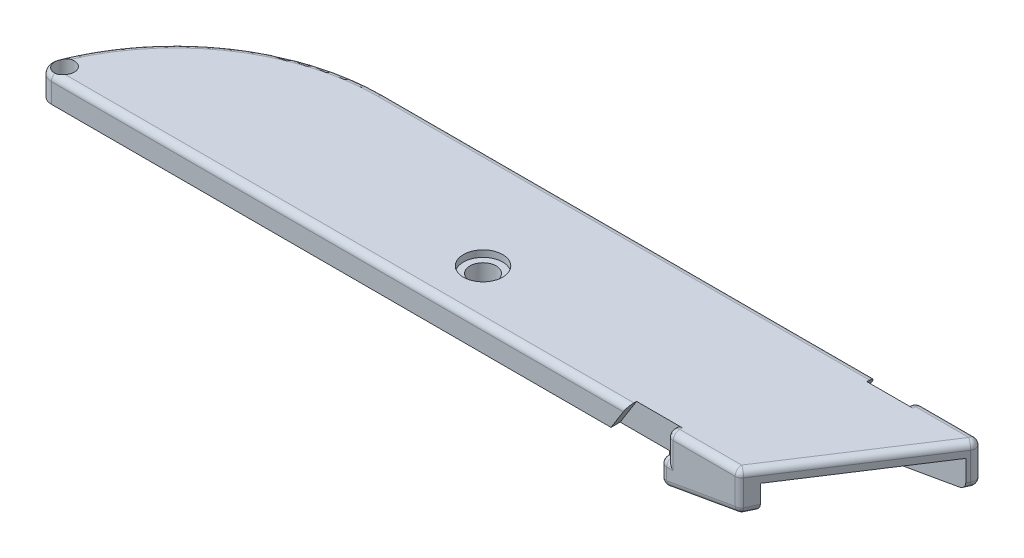
from build123d import *
from build123d.topology import SkipClean

# Parameters (mm, degrees)
BOSS_EXTRUDE1_DEPTH                                 = 10.16
CBORE_FOR_0_BINDING_HEAD_MACHINE_SCREW1_D           = 5.08
CBORE_FOR_0_BINDING_HEAD_MACHINE_SCREW1_CBORE_D     = 7.62
CBORE_FOR_0_BINDING_HEAD_MACHINE_SCREW1_CBORE_DEPTH = 1.27
SHELL1_OUTLINE_R                                    = 6.35
SHELL1_DEPTH                                        = 7.62
SHELL1_2_OUTLINE_R                                  = 6.35
SHELL1_2_OUTLINE_R_2                                = 5.08
SHELL1_2_DEPTH                                      = 6.35
CUT_EXTRUDE1_DEPTH                                  = 1.778
CUT_EXTRUDE2_DEPTH                                  = 1.778
CUT_EXTRUDE5_REACH                                  = 157.506
CUT_EXTRUDE6_REACH                                  = 157.506
CUT_EXTRUDE3_DEPTH                                  = 156.506301159
CUT_EXTRUDE3_DEPTH_BACK                             = 156.506301159
SKETCH4_W                                           = 120.65
SKETCH4_H                                           = 5.08
SKETCH5_W                                           = 19.05
SKETCH5_H                                           = 5.08
CUT_EXTRUDE4_DEPTH                                  = 2.54
SKETCH9_W                                           = 47.752
SKETCH9_H                                           = 3.81
CUT_EXTRUDE7_DEPTH                                  = 2.413
FILLET1_R                                           = 1.27
BOSS_EXTRUDE2_DEPTH                                 = 2.54
SKETCH11_W                                          = 40.132
SKETCH11_H                                          = 1.27
CUT_EXTRUDE9_DEPTH                                  = 6.858
SKETCH20_R                                          = 6.35
SKETCH20_R_2                                        = 5.08
CUT_EXTRUDE11_DEPTH                                 = 1.27
BOSS_EXTRUDE4_START                                 = 2.159
BOSS_EXTRUDE4_DEPTH                                 = 2.159
SKETCH36_R                                          = 1.905
CUT_EXTRUDE18_DEPTH                                 = 155.437689597


# Read off the part's stored shape, not the designer's step: Shell1
with BuildPart() as part:
    # Sketch1 → Boss-Extrude1 (new body)
    with BuildSketch(Plane(origin=(0, 0, 0), x_dir=(1, 0, 0), z_dir=(0, 1, 0))):
        with BuildLine():
            Line((0, 0), (133.35, 0))
            Line((133.35, 0), (152.4, 29.21))
            Line((152.4, 29.21), (35.446425772, 29.21))
            ThreePointArc((35.446425772, 29.21), (12.577020299, 22.164640842), (-2.363095051, 3.471333333))
            ThreePointArc((-2.363095051, 3.471333333), (-2.099665053, 1.110662158), (0, 0))
        make_face()
    extrude(amount=BOSS_EXTRUDE1_DEPTH)

    # CBORE for #0 Binding Head Machine Screw1 (through all)
    with Locations(Plane(origin=(0, 10.16, 0), x_dir=(1, 0, 0), z_dir=(0, 1, 0))):
        with Locations((74.100334947, 9.652)):
            CounterBoreHole(CBORE_FOR_0_BINDING_HEAD_MACHINE_SCREW1_D / 2, CBORE_FOR_0_BINDING_HEAD_MACHINE_SCREW1_CBORE_D / 2, CBORE_FOR_0_BINDING_HEAD_MACHINE_SCREW1_CBORE_DEPTH)

    # Shell1 outline → Shell1 (cut)
    with BuildSketch(Plane(origin=(0, 0, 0), x_dir=(1, 0, 0), z_dir=(0, 1, 0))):
        with BuildLine():
            Line((150.743478261, 26.67), (35.446425772, 26.67))
            ThreePointArc((35.446425772, 26.67), (14.006358141, 20.06497579), (0, 2.54))
            Line((0, 2.54), (135.006521739, 2.54))
            Line((135.006521739, 2.54), (150.743478261, 26.67))
        make_face()
        with Locations((74.100334947, 9.652)):
            Circle(SHELL1_OUTLINE_R, mode=Mode.SUBTRACT)
    extrude(amount=SHELL1_DEPTH, mode=Mode.SUBTRACT)

    # Shell1 2 outline → Shell1 2 (cut)
    with BuildSketch(Plane(origin=(0, 0, 0), x_dir=(1, 0, 0), z_dir=(0, 1, 0))):
        with Locations((74.100334947, 9.652)):
            Circle(SHELL1_2_OUTLINE_R)
        with Locations((74.100334947, 9.652)):
            Circle(SHELL1_2_OUTLINE_R_2, mode=Mode.SUBTRACT)
    extrude(amount=SHELL1_2_DEPTH, mode=Mode.SUBTRACT)

    # Sketch2 → Cut-Extrude1 (cut)
    with BuildSketch(Plane.XY):
        Polygon((118.11, 0), (118.11, 5.08), (119.38, 5.08), (119.38, 10.16), (111.76, 10.16), (105.41, 0), align=None)
    extrude(amount=-CUT_EXTRUDE1_DEPTH, mode=Mode.SUBTRACT)

    # Sketch3 → Cut-Extrude2 (cut)
    with BuildSketch(Plane(origin=(0, 0, -29.21), x_dir=(-1, 0, 0), z_dir=(0, 0, -1))):
        Polygon((-138.43, 10.16), (-138.43, 5.08), (-137.16, 5.08), (-137.16, 0), (-124.46, 0), (-130.81, 10.16), align=None)
    extrude(amount=-CUT_EXTRUDE2_DEPTH, mode=Mode.SUBTRACT)

    # Cut-Extrude5: up to this face of the body (flat: up to its plane)
    cut_extrude5_end = Plane(part.part.faces().sort_by_distance((67.503260869, 3.81, -2.54))[0])
    # Sketch7 → Cut-Extrude5 (cut, up to the picked face)
    with BuildSketch(Plane.XY, mode=Mode.PRIVATE) as cut_extrude5_sk1:
        Polygon((135.006521739, 2.979312663), (118.11, 0), (135.006521739, 0), align=None)
    cut_extrude5_tool1 = split(extrude(cut_extrude5_sk1.sketch, amount=-CUT_EXTRUDE5_REACH, mode=Mode.PRIVATE), bisect_by=cut_extrude5_end, keep=Keep.BOTH, mode=Mode.PRIVATE)
    add(cut_extrude5_tool1.solids().sort_by(Axis((129.374348, 0.993104, 0), (0, 0, -1)))[0], mode=Mode.SUBTRACT)

    # Cut-Extrude6: up to this face of the body (flat: up to its plane)
    cut_extrude6_end = Plane(part.part.faces().sort_by_distance((93.094952017, 3.81, -26.67))[0])
    # Sketch8 → Cut-Extrude6 (cut, up to the picked face)
    with BuildSketch(Plane(origin=(0, 0, -29.21), x_dir=(-1, 0, 0), z_dir=(0, 0, -1)), mode=Mode.PRIVATE) as cut_extrude6_sk1:
        Polygon((-152.4, 2.687223186), (-137.16, 0), (-152.4, 0), align=None)
    cut_extrude6_tool1 = split(extrude(cut_extrude6_sk1.sketch, amount=-CUT_EXTRUDE6_REACH, mode=Mode.PRIVATE), bisect_by=cut_extrude6_end, keep=Keep.BOTH, mode=Mode.PRIVATE)
    add(cut_extrude6_tool1.solids().sort_by(Axis((147.32, 0.895741, -29.21), (0, 0, 1)))[0], mode=Mode.SUBTRACT)

    # Sketch4 → Cut-Extrude3 (cut, two sides: drawn at the far end of the back side and taken through both)
    with BuildSketch(Plane.XY.offset(-CUT_EXTRUDE3_DEPTH_BACK)):
        with Locations((57.785, 2.54)):
            Rectangle(SKETCH4_W, SKETCH4_H)
    extrude(amount=CUT_EXTRUDE3_DEPTH + CUT_EXTRUDE3_DEPTH_BACK, mode=Mode.SUBTRACT)

    # Sketch5 → Cut-Extrude4 (cut)
    with BuildSketch(Plane(origin=(0, 0, -29.21), x_dir=(-1, 0, 0), z_dir=(0, 0, -1))):
        with Locations((-127.635, 2.54)):
            Rectangle(SKETCH5_W, SKETCH5_H)
    extrude(amount=-CUT_EXTRUDE4_DEPTH, mode=Mode.SUBTRACT)

    # Sketch9 → Cut-Extrude7 (cut)
    with BuildSketch(Plane(origin=(0, 0, -29.21), x_dir=(-1, 0, 0), z_dir=(0, 0, -1))):
        with Locations((-99.949, 6.985)):
            Rectangle(SKETCH9_W, SKETCH9_H)
    extrude(amount=-CUT_EXTRUDE7_DEPTH, mode=Mode.SUBTRACT)

    # Fillet1
    fillet1_edges = [part.edges().sort_by_distance(p)[0] for p in [
        (145.415, 10.16, -29.21),
        (142.875, 10.16, -14.605),
        (126.365, 10.16, 0),
        (119.38, 10.16, -0.889),
        (55.88, 10.16, 0),
        (-2.099665053, 10.16, -1.110662158),
        (12.577020299, 10.16, -22.164640842),
        (83.128212886, 10.16, -29.21),
        (138.43, 10.16, -28.321),
        (133.35, 6.423611593, 0),
        (152.4, 6.423611593, -29.21),
        (0, 6.35, -2.54),
        (118.745, 5.08, 0),
        (118.11, 2.54, 0),
        (119.38, 7.62, 0),
        (137.16, 2.54, -29.21),
        (137.795, 5.08, -29.21),
        (138.43, 7.62, -29.21),
        (144.78, 1.343611593, -29.21),
        (125.73, 1.343611593, 0),
        (151.57173913, 2.541178448, -27.94),
        (134.17826087, 2.833267924, -1.27),
        (137.16, 5.08, -28.321),
        (118.11, 0, -1.27),
        (118.11, 5.08, -0.889),
        (137.16, 0, -27.94),
    ]]
    fillet(fillet1_edges, radius=FILLET1_R - 0.0001)  # a hair under: the kernel refuses the full size

    # Sketch10 → Boss-Extrude2 (add)
    with BuildSketch(Plane.XZ.offset(-7.62)):
        Polygon((79.883, -21.717), (79.883, -26.67), (112.903, -26.67), (112.903, -19.939), (110.363, -19.939), (110.363, -23.749), (105.283, -23.749), (105.283, -21.717), (102.743, -21.717), (102.743, -23.749), (100.203, -23.749), (100.203, -21.717), (97.663, -21.717), (97.663, -23.749), (95.123, -23.749), (95.123, -21.717), (92.583, -21.717), (92.583, -23.749), (90.043, -23.749), (90.043, -21.717), (87.503, -21.717), (87.503, -23.749), (84.963, -23.749), (84.963, -21.717), align=None)
    extrude(amount=BOSS_EXTRUDE2_DEPTH)

    # Sketch11 → Cut-Extrude9 (cut)
    with BuildSketch(Plane(origin=(0, 0, -26.797), x_dir=(-1, 0, 0), z_dir=(0, 0, -1))):
        with Locations((-99.949, 5.715)):
            Rectangle(SKETCH11_W, SKETCH11_H)
    extrude(amount=-CUT_EXTRUDE9_DEPTH, mode=Mode.SUBTRACT)

    # Sketch20 → Cut-Extrude11 (cut)
    with SkipClean():  # the faces are left unmerged after this step: merging them gives an invalid solid
        with BuildSketch(Plane.XZ.offset(-6.35)):
            with Locations((74.100334947, -9.652)):
                Circle(SKETCH20_R)
            with Locations(Location((74.100334947, -9.652, 0), (0, 0, 90))):
                Circle(SKETCH20_R_2, mode=Mode.SUBTRACT)
        extrude(amount=-CUT_EXTRUDE11_DEPTH, mode=Mode.SUBTRACT)

    # Sketch21 → Boss-Extrude4 (add)
    with BuildSketch(Plane.XZ.offset(-7.62).offset(BOSS_EXTRUDE4_START)):
        with BuildLine():
            Line((74.100334947, -2.54), (74.100334947, -4.572))
            ThreePointArc((74.100334947, -4.572), (73.196935106, -4.652973222), (72.322334947, -4.893311525))
            Line((72.322334947, -4.893311525), (72.322334947, -2.54))
            Line((72.322334947, -2.54), (74.100334947, -2.54))
        make_face()
        with BuildLine():
            Line((74.100334947, -14.732), (74.100334947, -26.67))
            Line((74.100334947, -26.67), (72.322334947, -26.67))
            Line((72.322334947, -26.67), (72.322334947, -14.410688475))
            ThreePointArc((72.322334947, -14.410688475), (73.196935106, -14.651026778), (74.100334947, -14.732))
        make_face()
    extrude(amount=-BOSS_EXTRUDE4_DEPTH)

    # Sketch36 → Cut-Extrude18 (cut, through all)
    with SkipClean():  # the faces are left unmerged after this step: merging them gives an invalid solid
        with BuildSketch(Plane(origin=(0, 10.16, 0), x_dir=(1, 0, 0), z_dir=(0, 1, 0))):
            with Locations(Location((0, 2.54, 0), (0, 0, 270))):
                Circle(SKETCH36_R)
        extrude(amount=-CUT_EXTRUDE18_DEPTH, mode=Mode.SUBTRACT)


solid = part.part
